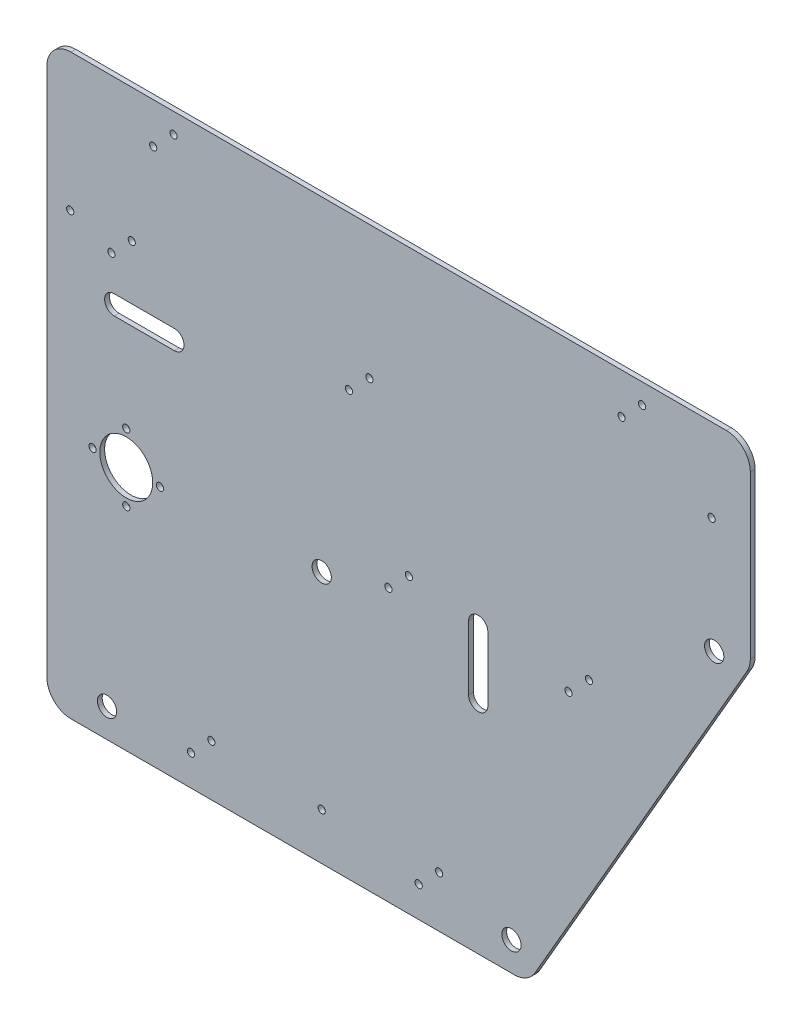
from build123d import *

# Parameters (mm, degrees)
BOSS_EXTRUDE1_DEPTH = 2
SKETCH2_R           = 4
SKETCH2_R_2         = 11
SKETCH2_R_3         = 1.5
CUT_EXTRUDE1_DEPTH  = 3
SKETCH4_W           = 292.37604307
SKETCH4_H           = 50
BOSS_EXTRUDE2_DEPTH = 2
FILLET1_R           = 10
SKETCH5_R           = 1.5
CUT_EXTRUDE2_DEPTH  = 11


with BuildPart() as part:
    # Sketch1 → Boss-Extrude1 (new body)
    with BuildSketch(Plane.XY):
        Polygon((-100, 110), (-100, -80), (100, -80), (192.37604307, 80), (192.37604307, 110), align=None)
    extrude(amount=BOSS_EXTRUDE1_DEPTH)

    # Sketch2 → Cut-Extrude1 (cut)
    with BuildSketch(Plane.XY.offset(2)):
        with Locations((93.07179677, -68)):
            Circle(SKETCH2_R)
        with Locations((177.364936071, 78)):
            Circle(SKETCH2_R)
        with Locations((-67, 22)):
            Circle(SKETCH2_R_2)
        with Locations((-75, -68)):
            Circle(SKETCH2_R)
        with Locations((-53, 22)):
            Circle(SKETCH2_R_3)
        with Locations((-67, 36)):
            Circle(SKETCH2_R_3)
        with Locations((-81, 22)):
            Circle(SKETCH2_R_3)
        with Locations((-67, 8)):
            Circle(SKETCH2_R_3)
        with Locations((54.54952947, -67.242640687)):
            Circle(SKETCH2_R_3)
        with Locations((63.034810844, -58.757359313)):
            Circle(SKETCH2_R_3)
        with Locations((14.225855729, -60.5)):
            Circle(SKETCH2_R_3)
        with Locations((-40.127135228, -67.242640687)):
            Circle(SKETCH2_R_3)
        with Locations((-31.641853854, -58.757359313)):
            Circle(SKETCH2_R_3)
        with Locations((-90.295627115, 102.881439108)):
            Circle(SKETCH2_R_3)
        with Locations((-73.186266887, 96.138798421)):
            Circle(SKETCH2_R_3)
        with Locations((-64.700985513, 104.624079796)):
            Circle(SKETCH2_R_3)
        with Locations((25.555567834, 96.138798421)):
            Circle(SKETCH2_R_3)
        with Locations((34.040849208, 104.624079796)):
            Circle(SKETCH2_R_3)
        with Locations((41.969500075, 33.138798421)):
            Circle(SKETCH2_R_3)
        with Locations((50.454781449, 41.624079796)):
            Circle(SKETCH2_R_3)
        with Locations((116.811272287, 33.138798421)):
            Circle(SKETCH2_R_3)
        with Locations((125.296553661, 41.624079796)):
            Circle(SKETCH2_R_3)
        with Locations((14.225855729, 25)):
            Circle(SKETCH2_R)
        with Locations((176.305585362, 125.488938255)):
            Circle(SKETCH2_R_3)
        with Locations((-55.814717647, 143.138798421)):
            Circle(SKETCH2_R_3)
        with Locations((-47.329436273, 151.624079796)):
            Circle(SKETCH2_R_3)
        with Locations((138.89162595, 143.138798421)):
            Circle(SKETCH2_R_3)
        with Locations((147.376907324, 151.624079796)):
            Circle(SKETCH2_R_3)
        with BuildLine():
            Line((75.290389443, 11.241781095), (75.290389443, 37.908558601))
            ThreePointArc((75.290389443, 37.908558601), (79.290389443, 41.908558601), (83.290389443, 37.908558601))
            Line((83.290389443, 37.908558601), (83.290389443, 11.241781095))
            ThreePointArc((83.290389443, 11.241781095), (79.290389443, 7.241781095), (75.290389443, 11.241781095))
        make_face()
        with BuildLine():
            Line((-72, 82), (-47, 82))
            ThreePointArc((-47, 82), (-43, 78), (-47, 74))
            Line((-47, 74), (-72, 74))
            ThreePointArc((-72, 74), (-76, 78), (-72, 82))
        make_face()
    extrude(amount=-CUT_EXTRUDE1_DEPTH, mode=Mode.SUBTRACT)

    # Sketch4 → Boss-Extrude2 (add)
    with BuildSketch(Plane.XY.offset(2)):
        with Locations((46.188021535, 135)):
            Rectangle(SKETCH4_W, SKETCH4_H)
    extrude(amount=-BOSS_EXTRUDE2_DEPTH)

    # Fillet1
    fillet1_edges = [part.edges().sort_by_distance(p)[0] for p in [
        (192.37604307, 160, 1),
        (192.37604307, 80, 1),
        (100, -80, 1),
        (-100, -80, 1),
        (-100, 160, 1),
    ]]
    fillet(fillet1_edges, radius=FILLET1_R)

    # Sketch5 → Cut-Extrude2 (cut)
    with BuildSketch(Plane.XY.offset(2)):
        with Locations((-55.814717647, 143.138798421)):
            Circle(SKETCH5_R)
        with Locations((-47.329436273, 151.624079796)):
            Circle(SKETCH5_R)
        with Locations((138.89162595, 143.138798421)):
            Circle(SKETCH5_R)
        with Locations((147.376907324, 151.624079796)):
            Circle(SKETCH5_R)
        with Locations((176.305585362, 125.488938255)):
            Circle(SKETCH5_R)
    extrude(amount=-CUT_EXTRUDE2_DEPTH, mode=Mode.SUBTRACT)


solid = part.part
